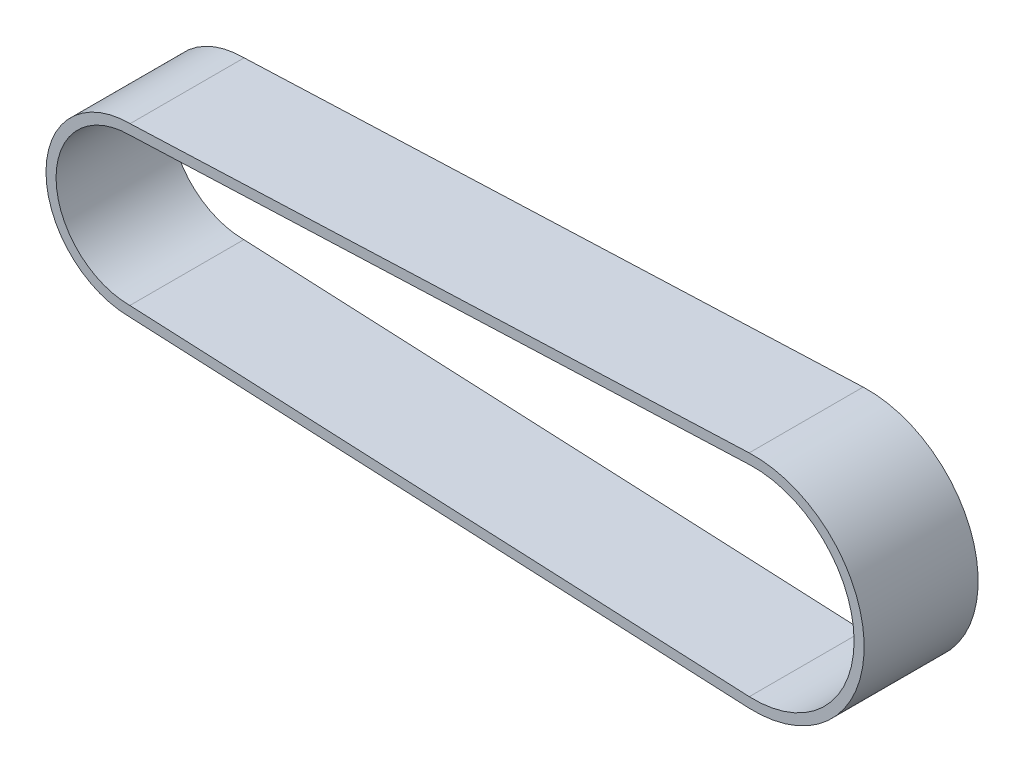
from build123d import *

# Parameters (mm, degrees)
BOSS_EXTRUDE1_DEPTH = 17


with BuildPart() as part:
    # Sketch1 → Boss-Extrude1 (new body)
    with BuildSketch(Plane.XY):
        with BuildLine():
            Line((0.041637985, 12.499930651), (92.349543667, 16.138010451))
            ThreePointArc((92.349543667, 16.138010451), (109.499327441, -0.372876258), (92.30220943, -16.834455634))
            Line((92.30220943, -16.834455634), (-0.036310221, -12.499947263))
            ThreePointArc((-0.036310221, -12.499947263), (-12.499939241, 0.038974104), (0.041637985, 12.499930651))
        make_face()
        with BuildLine():
            Line((0.067664916, 10.999791883), (92.408616464, 14.639174101))
            ThreePointArc((92.408616464, 14.639174101), (107.99933133, -0.369022938), (92.368982262, -15.335938331))
            Line((92.368982262, -15.335938331), (0, -11))
            ThreePointArc((0, -11), (-10.999947971, 0.033832618), (0.067664916, 10.999791883))
        make_face(mode=Mode.SUBTRACT)
    extrude(amount=BOSS_EXTRUDE1_DEPTH)


solid = part.part
